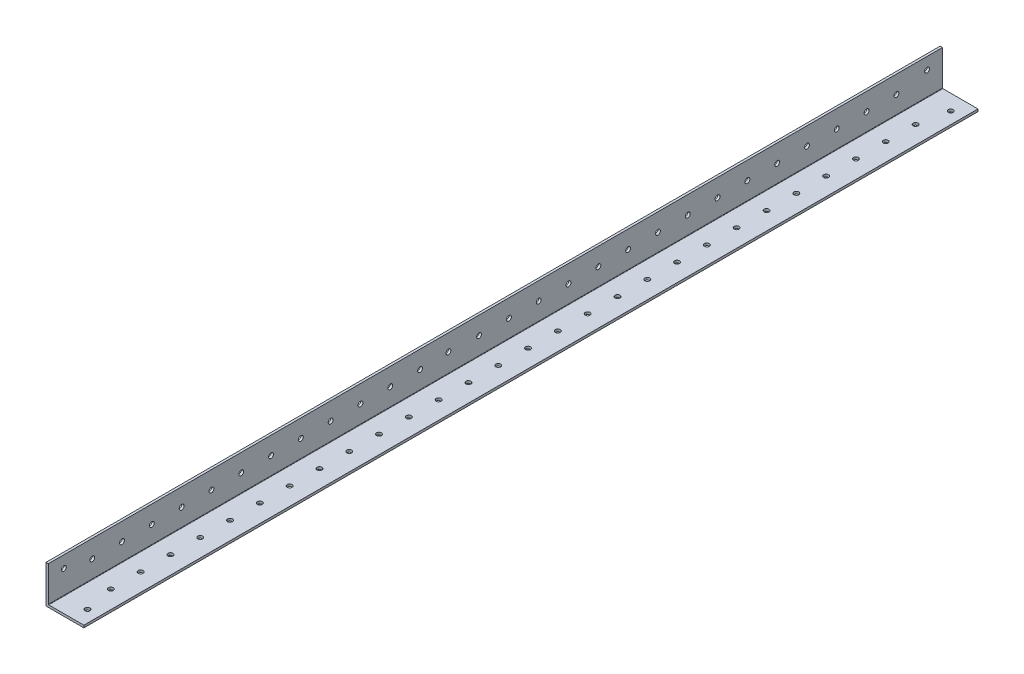
from build123d import *

# Parameters (mm, degrees)
BOSS_EXTRUDE1_DEPTH = 1219.2
FILLET1_R           = 0.254
SKETCH4_W           = 1838.4
SKETCH4_H           = 74.945320812
CUT_EXTRUDE1_DEPTH  = 60
SKETCH5_R           = 1.65
CUT_EXTRUDE2_DEPTH  = 10
SKETCH9_R           = 1.65
CUT_EXTRUDE6_DEPTH  = 60


with BuildPart() as part:
    # Sketch3 → Boss-Extrude1 (new, symmetric)
    with BuildSketch(Plane.XY):
        Polygon((1.5875, 25.4), (0, 25.4), (0, 0), (25.4, 0), (25.4, 1.5875), (1.5875, 1.5875), align=None)
    extrude(amount=BOSS_EXTRUDE1_DEPTH, both=True)

    # Fillet1
    fillet1_edges = [part.edges().sort_by_distance(p)[0] for p in [
        (1.5875, 1.5875, 0),
    ]]
    fillet(fillet1_edges, radius=FILLET1_R)

    # Sketch4 → Cut-Extrude1 (cut)
    with BuildSketch(Plane.ZY):
        with Locations((-300, 37.472660406)):
            Rectangle(SKETCH4_W, SKETCH4_H)
    extrude(amount=-CUT_EXTRUDE1_DEPTH, mode=Mode.SUBTRACT)

    # Sketch5 → Cut-Extrude2 (cut)
    with BuildSketch(Plane(origin=(0, 1.5875, 0), x_dir=(1, 0, 0), z_dir=(0, 1, 0))):
        with Locations((17.4625, -629.5759)):
            Circle(SKETCH5_R)
        with Locations((17.4625, -1208.8241)):
            Circle(SKETCH5_R)
        with Locations((13.49375, -1189.2)):
            Circle(SKETCH5_R)
        with Locations((13.49375, -1169.2)):
            Circle(SKETCH5_R)
        with Locations((13.49375, -1149.2)):
            Circle(SKETCH5_R)
        with Locations((13.49375, -1129.2)):
            Circle(SKETCH5_R)
        with Locations((13.49375, -1109.2)):
            Circle(SKETCH5_R)
        with Locations((13.49375, -1089.2)):
            Circle(SKETCH5_R)
        with Locations((13.49375, -1069.2)):
            Circle(SKETCH5_R)
        with Locations((13.49375, -1049.2)):
            Circle(SKETCH5_R)
        with Locations((13.49375, -1029.2)):
            Circle(SKETCH5_R)
        with Locations((13.49375, -1009.2)):
            Circle(SKETCH5_R)
        with Locations((13.49375, -989.2)):
            Circle(SKETCH5_R)
        with Locations((13.49375, -969.2)):
            Circle(SKETCH5_R)
        with Locations((13.49375, -949.2)):
            Circle(SKETCH5_R)
        with Locations((13.49375, -929.2)):
            Circle(SKETCH5_R)
        with Locations((13.49375, -909.2)):
            Circle(SKETCH5_R)
        with Locations((13.49375, -889.2)):
            Circle(SKETCH5_R)
        with Locations((13.49375, -869.2)):
            Circle(SKETCH5_R)
        with Locations((13.49375, -849.2)):
            Circle(SKETCH5_R)
        with Locations((13.49375, -829.2)):
            Circle(SKETCH5_R)
        with Locations((13.49375, -809.2)):
            Circle(SKETCH5_R)
        with Locations((13.49375, -789.2)):
            Circle(SKETCH5_R)
        with Locations((13.49375, -769.2)):
            Circle(SKETCH5_R)
        with Locations((13.49375, -749.2)):
            Circle(SKETCH5_R)
        with Locations((13.49375, -729.2)):
            Circle(SKETCH5_R)
        with Locations((13.49375, -709.2)):
            Circle(SKETCH5_R)
        with Locations((13.49375, -689.2)):
            Circle(SKETCH5_R)
        with Locations((13.49375, -669.2)):
            Circle(SKETCH5_R)
        with Locations((13.49375, -649.2)):
            Circle(SKETCH5_R)
    extrude(amount=-CUT_EXTRUDE2_DEPTH, mode=Mode.SUBTRACT)

    # Sketch9 → Cut-Extrude6 (cut)
    with BuildSketch(Plane(origin=(1.5875, 0, 0), x_dir=(0, 0, -1), z_dir=(1, 0, 0))):
        with Locations((-629.5759, 17.4625)):
            Circle(SKETCH9_R)
        with Locations((-1208.8241, 17.4625)):
            Circle(SKETCH9_R)
        with Locations((-950.70625, 14.2875)):
            Circle(SKETCH9_R)
        with Locations((-1189.765175, 13.49375)):
            Circle(SKETCH9_R)
        with Locations((-1169.765175, 13.49375)):
            Circle(SKETCH9_R)
        with Locations((-1149.765175, 13.49375)):
            Circle(SKETCH9_R)
        with Locations((-1129.765175, 13.49375)):
            Circle(SKETCH9_R)
        with Locations((-1109.765175, 13.49375)):
            Circle(SKETCH9_R)
        with Locations((-1089.765175, 13.49375)):
            Circle(SKETCH9_R)
        with Locations((-1069.765175, 13.49375)):
            Circle(SKETCH9_R)
        with Locations((-1049.765175, 13.49375)):
            Circle(SKETCH9_R)
        with Locations((-1029.765175, 13.49375)):
            Circle(SKETCH9_R)
        with Locations((-1009.765175, 13.49375)):
            Circle(SKETCH9_R)
        with Locations((-989.765175, 13.49375)):
            Circle(SKETCH9_R)
        with Locations((-969.765175, 13.49375)):
            Circle(SKETCH9_R)
        with Locations((-930.141075, 13.49375)):
            Circle(SKETCH9_R)
        with Locations((-910.141075, 13.49375)):
            Circle(SKETCH9_R)
        with Locations((-890.141075, 13.49375)):
            Circle(SKETCH9_R)
        with Locations((-870.141075, 13.49375)):
            Circle(SKETCH9_R)
        with Locations((-850.141075, 13.49375)):
            Circle(SKETCH9_R)
        with Locations((-830.141075, 13.49375)):
            Circle(SKETCH9_R)
        with Locations((-810.141075, 13.49375)):
            Circle(SKETCH9_R)
        with Locations((-790.141075, 13.49375)):
            Circle(SKETCH9_R)
        with Locations((-770.141075, 13.49375)):
            Circle(SKETCH9_R)
        with Locations((-750.141075, 13.49375)):
            Circle(SKETCH9_R)
        with Locations((-730.141075, 13.49375)):
            Circle(SKETCH9_R)
        with Locations((-710.141075, 13.49375)):
            Circle(SKETCH9_R)
        with Locations((-690.141075, 13.49375)):
            Circle(SKETCH9_R)
        with Locations((-670.141075, 13.49375)):
            Circle(SKETCH9_R)
        with Locations((-650.141075, 13.49375)):
            Circle(SKETCH9_R)
    extrude(amount=-CUT_EXTRUDE6_DEPTH, mode=Mode.SUBTRACT)


solid = part.part
